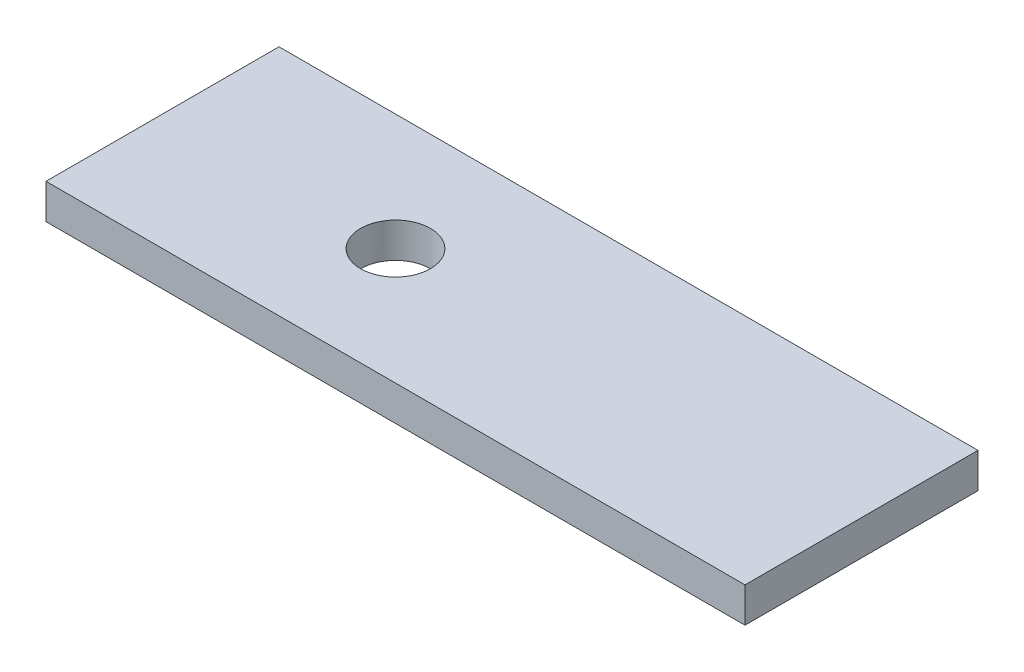
from build123d import *

# Parameters (mm, degrees)
SKETCH1_W                   = 30
SKETCH1_H                   = 10
BASE_FLANGE1_DEPTH          = 1.5
F_3_0MM_PRESS_DOWEL_HOLE1_D = 3


# Sheet-metal steps are written as plain solids
with BuildPart() as part:
    # Sketch1 → Base-Flange1 (new body)
    with BuildSketch(Plane(origin=(0, 0, 0), x_dir=(1, 0, 0), z_dir=(0, 1, 0))):
        with Locations((15, 5)):
            Rectangle(SKETCH1_W, SKETCH1_H)
    extrude(amount=-BASE_FLANGE1_DEPTH)

    # Ø3.0mm Press Dowel Hole1 (through all)
    with Locations(Plane(origin=(0, 0, 0), x_dir=(1, 0, 0), z_dir=(0, 1, 0))):
        with Locations((10, 5)):
            Hole(F_3_0MM_PRESS_DOWEL_HOLE1_D / 2)


solid = part.part
